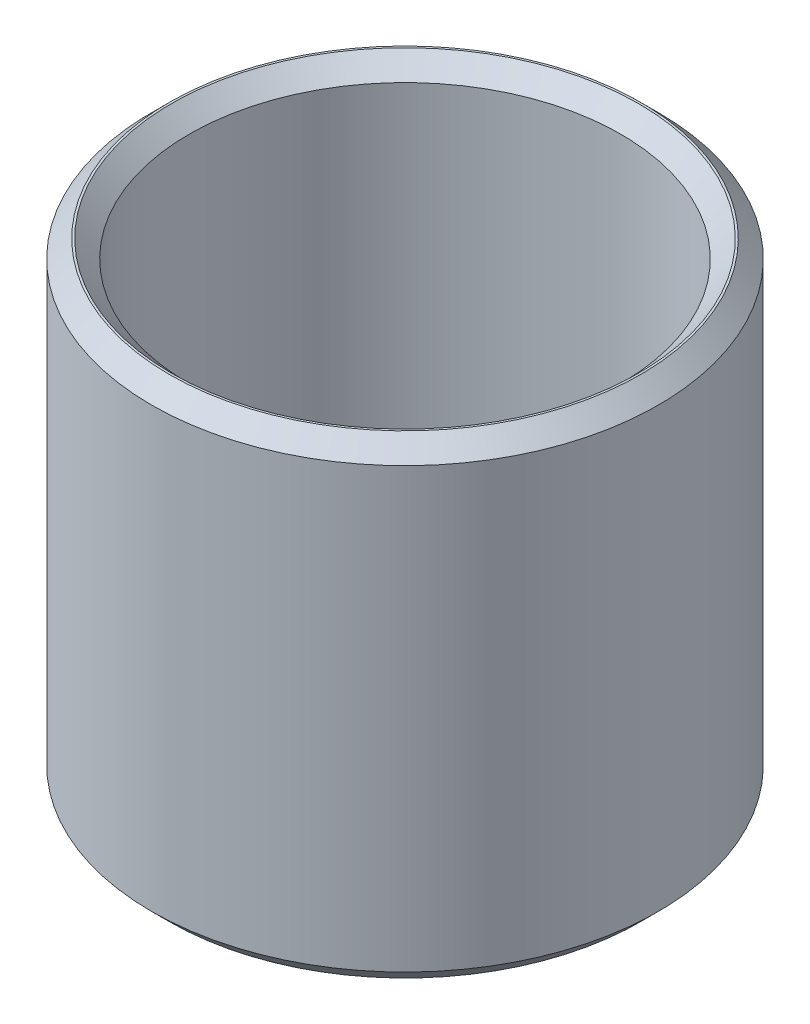
from build123d import *

# Parameters (mm, degrees)
SKETCH1_R           = 32.5
BOSS_EXTRUDE1_DEPTH = 60.791801945
SKETCH2_R           = 27.69421809
CUT_EXTRUDE1_DEPTH  = 77.211174927
CHAMFER1_SIZE       = 2.267081835


with BuildPart() as part:
    # Sketch1 → Boss-Extrude1 (new body)
    with BuildSketch(Plane(origin=(0, 0, 0), x_dir=(1, 0, 0), z_dir=(0, 1, 0))):
        Circle(SKETCH1_R)
    extrude(amount=BOSS_EXTRUDE1_DEPTH)

    # Sketch2 → Cut-Extrude1 (cut, through all)
    with BuildSketch(Plane(origin=(0, 0, 0), x_dir=(1, 0, 0), z_dir=(0, 1, 0))):
        Circle(SKETCH2_R)
    extrude(amount=CUT_EXTRUDE1_DEPTH, mode=Mode.SUBTRACT)

    # Chamfer1
    chamfer1_edges = [part.edges().sort_by_distance(p)[0] for p in [
        (-27.69421809, 60.791801945, 0),
        (-27.69421809, 0, 0),
        (-32.5, 0, 0),
        (-32.5, 60.791801945, 0),
    ]]
    chamfer(chamfer1_edges, length=CHAMFER1_SIZE)


solid = part.part
